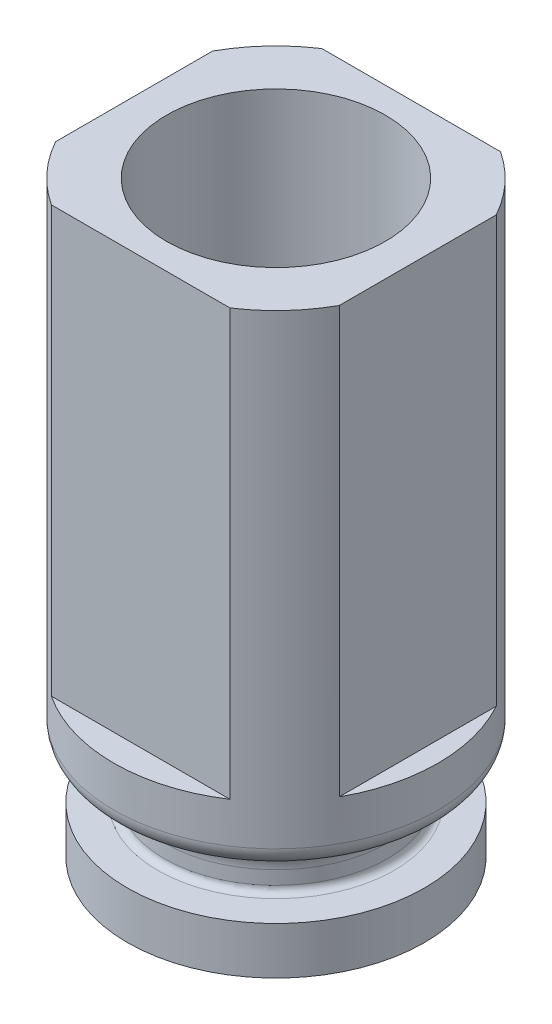
from build123d import *

# Parameters (mm, degrees)
SKETCH_1_R                 = 22
EXTRUDE_1_DEPTH            = 15
SKETCH_2_R                 = 14.5
CUT_EXTRUDE_2_DEPTH        = 6.5
SKETCH_4_R                 = 25
SKETCH_4_R_2               = 16.5
CUT_EXTRUDE_1_DEPTH        = 8
SKETCH_5_R                 = 24
SKETCH_5_R_2               = 16.2
EXTRUDE_4_DEPTH            = 72
FILLET_1_R                 = 1
FILLET_2_R                 = 5
FILLET_3_R                 = 3
CUT_EXTRUDE_2_2_DEPTH      = 50
CUT_EXTRUDE_2_2_DEPTH_BACK = 26
CUT_EXTRUDE_2_2_START      = 50
SKETCH_6_W                 = 42
SKETCH_6_H                 = 40.064513034


with BuildPart() as part:
    # Эскиз1 → Вытянуть1 (new body)
    with BuildSketch(Plane(origin=(0, 0, 0), x_dir=(1, 0, 0), z_dir=(0, 1, 0))):
        Circle(SKETCH_1_R)
    extrude(amount=EXTRUDE_1_DEPTH)

    # Эскиз2 → Cut-Extrude 2 (cut)
    with BuildSketch(Plane.XZ):
        Circle(SKETCH_2_R)
    extrude(amount=-CUT_EXTRUDE_2_DEPTH, mode=Mode.SUBTRACT)

    # Эскиз4 → Вырез-Вытянуть1 (cut)
    with BuildSketch(Plane(origin=(0, 15, 0), x_dir=(1, 0, 0), z_dir=(0, 1, 0))):
        Circle(SKETCH_4_R)
        Circle(SKETCH_4_R_2, mode=Mode.SUBTRACT)
    extrude(amount=-CUT_EXTRUDE_1_DEPTH, mode=Mode.SUBTRACT)

    # Эскиз5 → Вытянуть4 (add)
    with BuildSketch(Plane(origin=(0, 15, 0), x_dir=(1, 0, 0), z_dir=(0, 1, 0))):
        Circle(SKETCH_5_R)
        Circle(SKETCH_5_R_2, mode=Mode.SUBTRACT)
    extrude(amount=EXTRUDE_4_DEPTH)

    # Скругление1
    fillet_1_edges = [part.edges().sort_by_distance(p)[0] for p in [
        (-16.5, 7, 0),
    ]]
    fillet(fillet_1_edges, radius=FILLET_1_R)

    # Скругление2
    fillet_2_edges = [part.edges().sort_by_distance(p)[0] for p in [
        (-16.5, 15, 0),
    ]]
    fillet(fillet_2_edges, radius=FILLET_2_R)

    # Скругление3
    fillet_3_edges = [part.edges().sort_by_distance(p)[0] for p in [
        (-24, 15, 0),
    ]]
    fillet(fillet_3_edges, radius=FILLET_3_R)

    # Эскиз6 → Cut-Extrude 2 2 (cut, two sides: drawn at the far end of the back side and taken through both)
    with BuildSketch(Plane(origin=(0, 0, 0), x_dir=(1, 0, 0), z_dir=(0, 1, 0)).offset(CUT_EXTRUDE_2_2_START - CUT_EXTRUDE_2_2_DEPTH_BACK)):
        Polygon((21, 29.701884449), (36.425926694, 29.701884449), (36.425926694, -29.522725679), (-36.425926694, -29.522725679), (-36.425926694, 29.701884449), (-21, 29.701884449), align=None)
        Rectangle(SKETCH_6_W, SKETCH_6_H, mode=Mode.SUBTRACT)
    extrude(amount=CUT_EXTRUDE_2_2_DEPTH + CUT_EXTRUDE_2_2_DEPTH_BACK, mode=Mode.SUBTRACT)


solid = part.part
